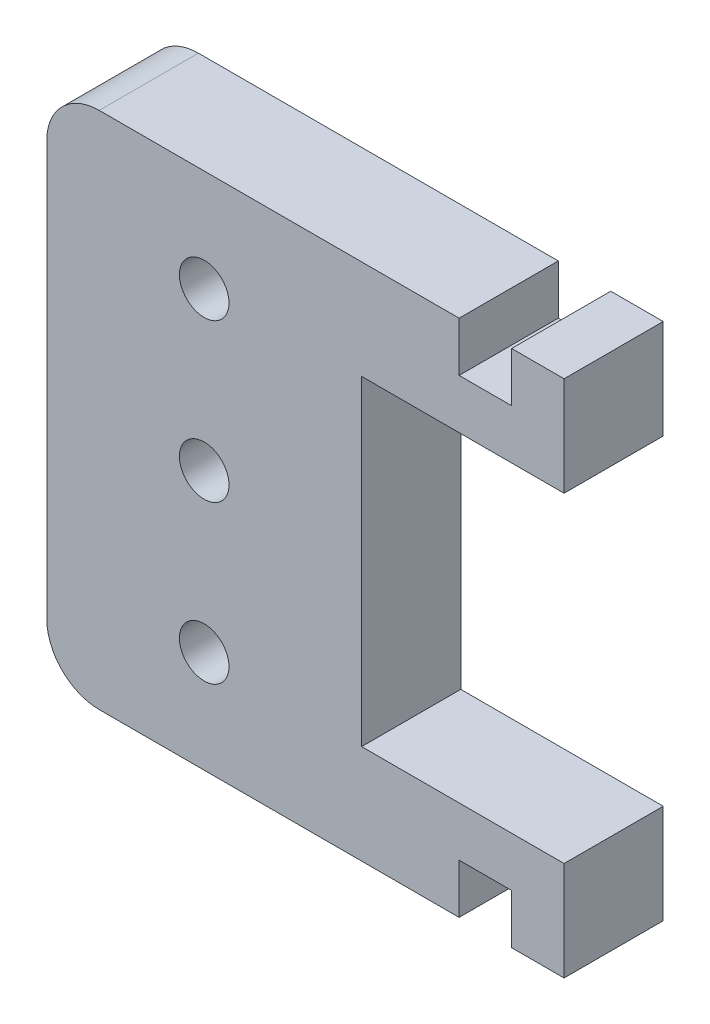
from build123d import *

# Parameters (mm, degrees)
BOSS_EXTRUDE1_DEPTH     = 3
FILLET1_R               = 3.175
CUT_EXTRUDE1_DEPTH      = 28.507101338
CUT_EXTRUDE1_DEPTH_BACK = 28.507101338
SKETCH2_R               = 1.5


with BuildPart() as part:
    # Sketch1 → Boss-Extrude1 (new, symmetric)
    with BuildSketch(Plane.XY):
        Polygon((15.425, -15.699999969), (15.425, -12.699999969), (18.6, -12.699999969), (18.6, -15.699999969), (21.775, -15.699999969), (21.775, -9.699999969), (9.525, -9.699999969), (9.525, 9.699999969), (21.775, 9.699999969), (21.775, 15.699999969), (18.6, 15.699999969), (18.6, 12.699999969), (15.425, 12.699999969), (15.425, 15.699999969), (-9.525, 15.699999969), (-9.525, -15.699999969), align=None)
    extrude(amount=BOSS_EXTRUDE1_DEPTH, both=True)

    # Fillet1
    fillet1_edges = [part.edges().sort_by_distance(p)[0] for p in [
        (-9.525, -15.699999969, 0),
        (-9.525, 15.699999969, 0),
    ]]
    fillet(fillet1_edges, radius=FILLET1_R)

    # Sketch2 → Cut-Extrude1 (cut, two sides: drawn at the far end of the back side and taken through both)
    with BuildSketch(Plane.XY.offset(3).offset(-CUT_EXTRUDE1_DEPTH_BACK)):
        with Locations((0, 9.525)):
            Circle(SKETCH2_R)
        with Locations((0, -9.525)):
            Circle(SKETCH2_R)
        Circle(SKETCH2_R)
    extrude(amount=CUT_EXTRUDE1_DEPTH + CUT_EXTRUDE1_DEPTH_BACK, mode=Mode.SUBTRACT)


solid = part.part
